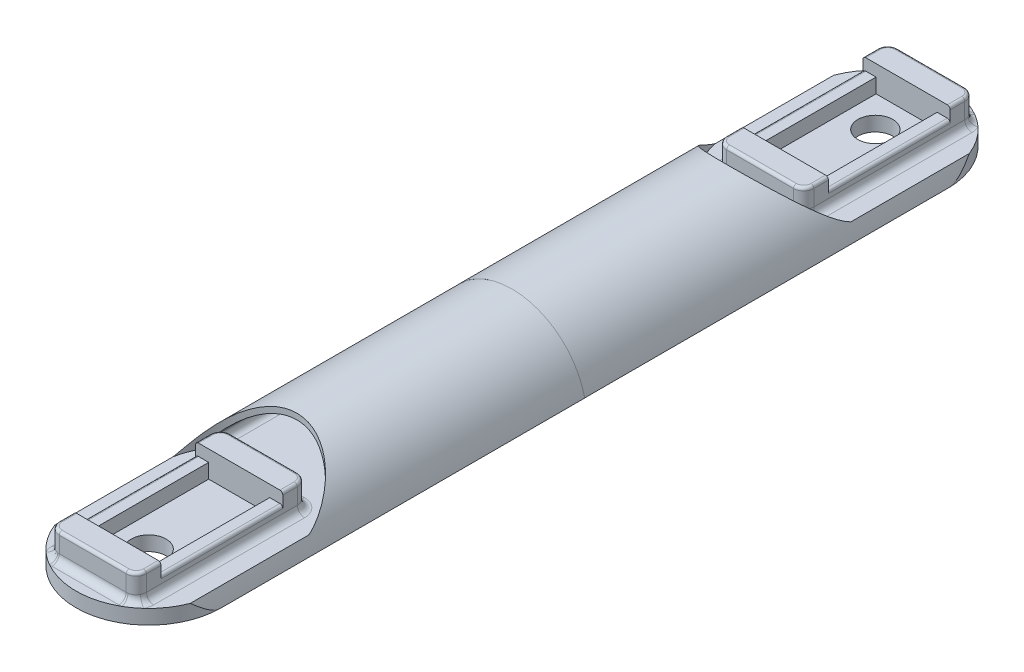
from build123d import *
from build123d.topology import SkipClean

# Parameters (mm, degrees)
BOSS_EXTRUDE1_DEPTH = 300
BOSS_EXTRUDE2_START = -300
BOSS_EXTRUDE2_DEPTH = 300
CUT_EXTRUDE2_DEPTH  = 200
CUT_EXTRUDE9_DEPTH  = 200
SKETCH6_R           = 6
CUT_EXTRUDE10_DEPTH = 200
BOSS_EXTRUDE3_DEPTH = 9
SKETCH9_W           = 4.5
SKETCH9_H           = 41.9
BOSS_EXTRUDE4_DEPTH = 5
FILLET1_R           = 2.5
FILLET2_R           = 1
FILLET3_R           = 1
SKETCH10_W          = 95.461402426
SKETCH10_H          = 159.627915675
CUT_EXTRUDE11_DEPTH = 305.795013204
CIRPATTERN1_COUNT   = 2


with BuildPart() as part:
    # Sketch2 → Boss-Extrude1 (new body)
    with BuildSketch(Plane.XY):
        with BuildLine():
            Line((0, 0), (50, 0))
            ThreePointArc((50, 0), (25, 20), (0, 0))
        make_face()
        with BuildLine():
            Line((2.639320225, 2), (47.360679775, 2))
            ThreePointArc((47.360679775, 2), (25, 18), (2.639320225, 2))
        make_face(mode=Mode.SUBTRACT)
    extrude(amount=BOSS_EXTRUDE1_DEPTH)

    # Sketch3 → Boss-Extrude2 (add)
    with BuildSketch(Plane.XY.offset(300).offset(BOSS_EXTRUDE2_START)):
        with BuildLine():
            Line((7.442950134, 5), (42.557049866, 5))
            ThreePointArc((42.557049866, 5), (44.336833577, 6.087656894), (44.180823264, 8.167630058))
            ThreePointArc((44.180823264, 8.167630058), (45.998429318, 5.201199295), (47.360679775, 2))
            Line((47.360679775, 2), (2.639320225, 2))
            ThreePointArc((2.639320225, 2), (4.001570682, 5.201199295), (5.819176736, 8.167630058))
            ThreePointArc((5.819176736, 8.167630058), (5.663166423, 6.087656894), (7.442950134, 5))
        make_face()
    extrude(amount=BOSS_EXTRUDE2_DEPTH)

    # Sketch4 → Cut-Extrude2 (cut)
    with SkipClean():  # the faces are left unmerged after this step: merging them gives an invalid solid
        with BuildSketch(Plane.XZ):
            with BuildLine():
                Line((0, 300), (0, 275))
                ThreePointArc((0, 275), (7.32233047, 292.67766953), (25, 300))
                Line((25, 300), (0, 300))
            make_face()
            with BuildLine():
                ThreePointArc((25, 300), (42.67766953, 292.67766953), (50, 275))
                Line((50, 275), (50, 300))
                Line((50, 300), (25, 300))
            make_face()
            with BuildLine():
                ThreePointArc((25, 0), (7.32233047, 7.32233047), (0, 25))
                Line((0, 25), (0, 0))
                Line((0, 0), (25, 0))
            make_face()
            with BuildLine():
                Line((50, 0), (50, 25))
                ThreePointArc((50, 25), (42.67766953, 7.32233047), (25, 0))
                Line((25, 0), (50, 0))
            make_face()
        extrude(amount=-CUT_EXTRUDE2_DEPTH, mode=Mode.SUBTRACT)

    # Sketch5 → Cut-Extrude9 (cut)
    with BuildSketch(Plane(origin=(0, 5, 0), x_dir=(1, 0, 0), z_dir=(0, 1, 0))):
        with BuildLine():
            Line((1.25, -13.574535091), (1.25, -52.25))
            ThreePointArc((1.25, -52.25), (25, -76), (48.75, -52.25))
            Line((48.75, -52.25), (48.75, -2.375185437))
            Line((48.75, -2.375185437), (43.657777438, 1.49490371))
            Line((43.657777438, 1.49490371), (14.161754885, 8.550430699))
            Line((14.161754885, 8.550430699), (1.25, -13.574535091))
        make_face()
        with BuildLine():
            ThreePointArc((48.75, -247.75), (25, -224), (1.25, -247.75))
            Line((1.25, -247.75), (1.25, -286.425464909))
            Line((1.25, -286.425464909), (14.161754885, -308.550430699))
            Line((14.161754885, -308.550430699), (43.657777438, -301.49490371))
            Line((43.657777438, -301.49490371), (48.75, -297.624814563))
            Line((48.75, -297.624814563), (48.75, -247.75))
        make_face()
    extrude(amount=CUT_EXTRUDE9_DEPTH, mode=Mode.SUBTRACT)

    # Sketch6 → Cut-Extrude10 (cut)
    with BuildSketch(Plane(origin=(0, 5, 0), x_dir=(1, 0, 0), z_dir=(0, 1, 0))):
        with Locations((25, -25)):
            Circle(SKETCH6_R)
        with Locations((25, -275)):
            Circle(SKETCH6_R)
    extrude(amount=-CUT_EXTRUDE10_DEPTH, mode=Mode.SUBTRACT)

    # Sketch8 → Boss-Extrude3 (add)
    with BuildSketch(Plane(origin=(0, 5, 0), x_dir=(1, 0, 0), z_dir=(0, 1, 0))):
        with BuildLine():
            Line((9.98580684, -238.84339065), (9.98580684, -243.84339065))
            Line((9.98580684, -243.84339065), (39.98580684, -243.84339065))
            Line((39.98580684, -243.84339065), (39.98580684, -238.84339065))
            ThreePointArc((39.98580684, -238.84339065), (38.960680574, -236.368516915), (36.48580684, -235.34339065))
            Line((36.48580684, -235.34339065), (13.48580684, -235.34339065))
            ThreePointArc((13.48580684, -235.34339065), (11.010933106, -236.368516915), (9.98580684, -238.84339065))
        make_face()
        with BuildLine():
            Line((39.98580684, -285.74339065), (9.98580684, -285.74339065))
            Line((9.98580684, -285.74339065), (9.98580684, -290.74339065))
            ThreePointArc((9.98580684, -290.74339065), (11.010933106, -293.218264384), (13.48580684, -294.24339065))
            Line((13.48580684, -294.24339065), (36.48580684, -294.24339065))
            ThreePointArc((36.48580684, -294.24339065), (38.960680574, -293.218264384), (39.98580684, -290.74339065))
            Line((39.98580684, -290.74339065), (39.98580684, -285.74339065))
        make_face()
    extrude(amount=BOSS_EXTRUDE3_DEPTH)

    # Sketch9 → Boss-Extrude4 (add)
    with BuildSketch(Plane(origin=(0, 5, 0), x_dir=(1, 0, 0), z_dir=(0, 1, 0))):
        with Locations((12.23580684, -264.79339065)):
            Rectangle(SKETCH9_W, SKETCH9_H)
        with Locations((37.73580684, -264.79339065)):
            Rectangle(SKETCH9_W, SKETCH9_H)
    extrude(amount=BOSS_EXTRUDE4_DEPTH)

    # Fillet1
    fillet1_edges = [part.edges().sort_by_distance(p)[0] for p in [
        (11.010933106, 5, 293.218264384),
        (24.98580684, 5, 294.24339065),
        (38.960680574, 5, 293.218264384),
        (39.98580684, 5, 264.79339065),
        (38.960680574, 5, 236.368516915),
        (24.98580684, 5, 235.34339065),
        (11.010933106, 5, 236.368516915),
        (9.98580684, 5, 264.79339065),
    ]]
    fillet(fillet1_edges, radius=FILLET1_R)

    # Fillet2
    fillet2_edges = [part.edges().sort_by_distance(p)[0] for p in [
        (9.98580684, 14, 241.34339065),
        (11.010933106, 14, 236.368516915),
        (39.98580684, 14, 241.34339065),
        (38.960680574, 14, 236.368516915),
        (24.98580684, 14, 235.34339065),
        (9.98580684, 14, 288.24339065),
        (11.010933106, 14, 293.218264384),
        (39.98580684, 14, 288.24339065),
        (38.960680574, 14, 293.218264384),
        (24.98580684, 14, 294.24339065),
    ]]
    fillet(fillet2_edges, radius=FILLET2_R)

    # Fillet3
    fillet3_edges = [part.edges().sort_by_distance(p)[0] for p in [
        (9.98580684, 10, 264.79339065),
        (39.98580684, 10, 264.79339065),
    ]]
    fillet(fillet3_edges, radius=FILLET3_R)

    # Sketch10 → Cut-Extrude11 (cut, through all)
    with BuildSketch(Plane(origin=(0, 0, 0), x_dir=(1, 0, 0), z_dir=(0, 1, 0))):
        with Locations((25.101011536, -70.186042163)):
            Rectangle(SKETCH10_W, SKETCH10_H)
    extrude(amount=CUT_EXTRUDE11_DEPTH, mode=Mode.SUBTRACT)


with BuildPart() as cirpattern1_1:
    # CirPattern1: pattern copy
    add(part.part.rotate(Axis((24.98580684, 21, 150), (0, -1, 0)), 1 * 360 / CIRPATTERN1_COUNT))

    # Combine2: union part
    add(part.part)


solid = cirpattern1_1.part
